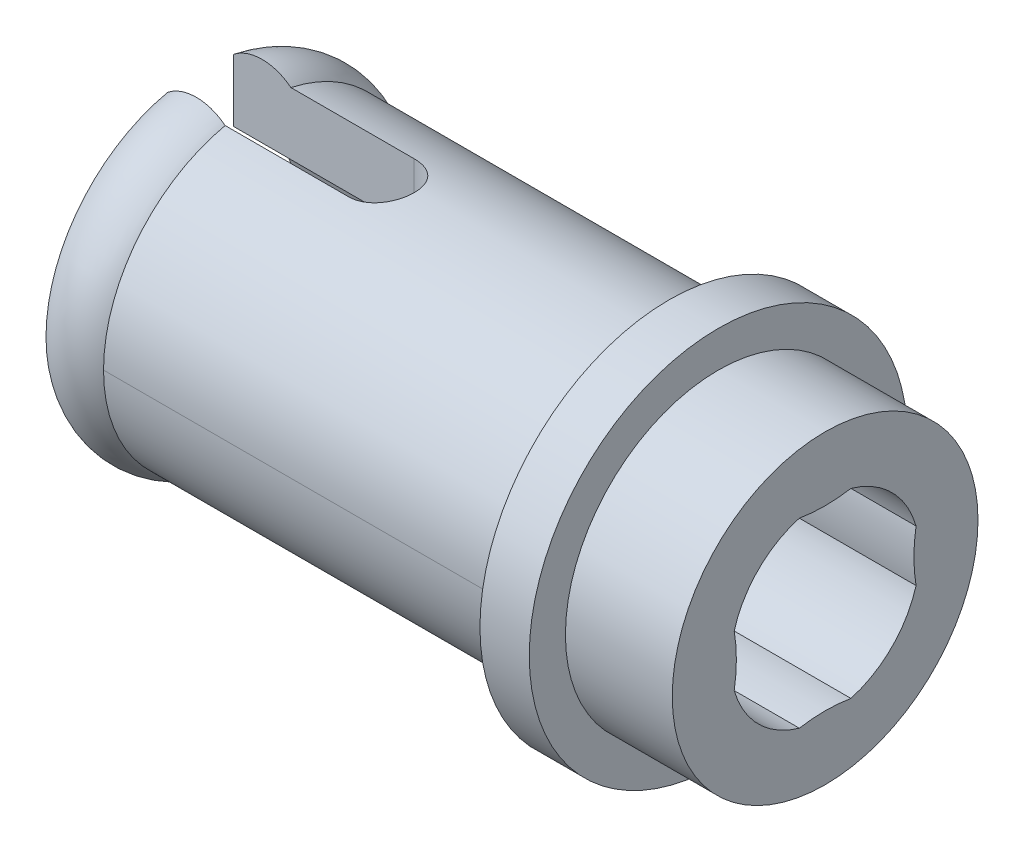
from build123d import *

# Parameters (mm, degrees)
SKETCH1_R               = 2.3622
BASE_EXTRUDE_DEPTH      = 1.651
SKETCH3_R               = 2.921
BOSS_EXTRUDE1_DEPTH     = 0.762
SKETCH4_R               = 2.3876
BOSS_EXTRUDE2_DEPTH     = 7.239
SKETCH7_R               = 1.4605
CUT_EXTRUDE2_DEPTH      = 11.498837364
CUT_EXTRUDE4_DEPTH      = 10.004470257
CUT_EXTRUDE4_DEPTH_BACK = 10.004470257
BOSS_EXTRUDE11_START    = -3.937
BOSS_EXTRUDE11_DEPTH    = 3.937
CIRPATTERN1_COUNT       = 4


with BuildPart() as part:
    # Sketch1 → Base-Extrude (new body)
    with BuildSketch(Plane(origin=(0, 0, 0), x_dir=(0, 0, -1), z_dir=(1, 0, 0))):
        Circle(SKETCH1_R)
    extrude(amount=BASE_EXTRUDE_DEPTH)

    # Sketch3 → Boss-Extrude1 (add)
    with BuildSketch(Plane.ZY):
        Circle(SKETCH3_R)
    extrude(amount=BOSS_EXTRUDE1_DEPTH)

    # Sketch4 → Boss-Extrude2 (add)
    with BuildSketch(Plane.ZY.offset(0.762)):
        Circle(SKETCH4_R)
    extrude(amount=BOSS_EXTRUDE2_DEPTH)

    # Sketch6 → Boss-Revolve2 (revolve)
    with BuildSketch(Plane(origin=(0, 0, 0), x_dir=(1, 0, 0), z_dir=(0, 1, 0))):
        with BuildLine():
            Line((-8.001, 2.3876), (-7.112, 2.3876))
            ThreePointArc((-7.112, 2.3876), (-7.5565, 2.54), (-8.001, 2.3876))
        make_face()
    revolve(axis=Axis((0, 0, 0), (-1, 0, 0)))

    # Sketch7 → Cut-Extrude2 (cut, through all)
    with BuildSketch(Plane.ZY.offset(8.001)):
        Circle(SKETCH7_R)
    extrude(amount=-CUT_EXTRUDE2_DEPTH, mode=Mode.SUBTRACT)

    # Sketch8 → Cut-Extrude4 (cut, two sides: drawn at the far end of the back side and taken through both)
    with BuildSketch(Plane(origin=(0, 0, 0), x_dir=(1, 0, 0), z_dir=(0, 1, 0)).offset(-CUT_EXTRUDE4_DEPTH_BACK)):
        with BuildLine():
            Line((-8.001, 0.508), (-5.207, 0.508))
            ThreePointArc((-5.207, 0.508), (-4.699, 0), (-5.207, -0.508))
            Line((-5.207, -0.508), (-8.001, -0.508))
            Line((-8.001, -0.508), (-8.001, 0.508))
        make_face()
    extrude(amount=CUT_EXTRUDE4_DEPTH + CUT_EXTRUDE4_DEPTH_BACK, mode=Mode.SUBTRACT)

    # Sketch11 → Boss-Extrude11 (add)
    with BuildSketch(Plane(origin=(1.651, 0, 0), x_dir=(0, 0, -1), z_dir=(1, 0, 0)).offset(BOSS_EXTRUDE11_START)):
        with BuildLine():
            ThreePointArc((0.39848324, 1.405087669), (0, 1.4605), (-0.39848324, 1.405087669))
            ThreePointArc((-0.39848324, 1.405087669), (0, 1.3716), (0.39848324, 1.405087669))
        make_face()
    boss_extrude11 = extrude(amount=BOSS_EXTRUDE11_DEPTH)

    # CirPattern1: Boss-Extrude11 ×4 about axis
    cirpattern1_axis = Axis((1.651, 0, 0), (-1, 0, 0))
    for i in range(1, CIRPATTERN1_COUNT):
        add(boss_extrude11.rotate(cirpattern1_axis, i * 360 / CIRPATTERN1_COUNT))


solid = part.part
